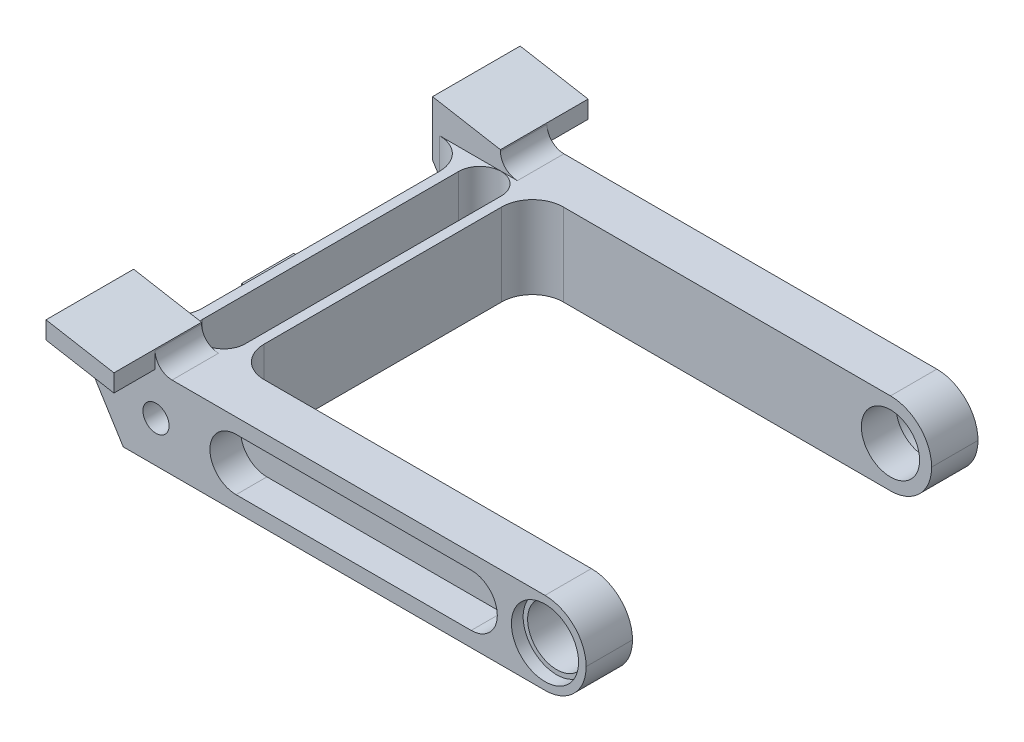
from build123d import *

# Parameters (mm, degrees)
BOSS_EXTRUDE1_DEPTH = 10.9474
CUT_EXTRUDE1_DEPTH  = 66.230102934
CUT_EXTRUDE2_DEPTH  = 63.46692107
SKETCH4_W           = 29.0576
SKETCH4_H           = 2.9464
CUT_EXTRUDE3_DEPTH  = 10.9474
CUT_EXTRUDE4_DEPTH  = 6.5278
FILLET1_R           = 4.0005
CUT_EXTRUDE5_DEPTH  = 66.230102934
CUT_EXTRUDE6_DEPTH  = 4.0005
CUT_EXTRUDE7_DEPTH  = 4.0005
SKETCH9_R           = 2.8321
CUT_EXTRUDE8_DEPTH  = 63.46692107
SKETCH10_R          = 3.2639
CUT_EXTRUDE9_DEPTH  = 1.143
CUT_EXTRUDE10_START = -1.143
SKETCH11_R          = 3.2639
CUT_EXTRUDE10_DEPTH = 1.143
CUT_EXTRUDE11_DEPTH = 2.9972
CUT_EXTRUDE13_START = -2.9972
CUT_EXTRUDE13_DEPTH = 2.9972
SKETCH14_R          = 1.27
CUT_EXTRUDE14_DEPTH = 63.46692107
SKETCH15_R          = 0.8382
BOSS_EXTRUDE2_DEPTH = 2.9972
CUT_EXTRUDE15_DEPTH = 4.0005
CUT_EXTRUDE16_DEPTH = 4.0005
SCALE1_SCALE        = 0.6


with BuildPart() as part:
    # Sketch1 → Boss-Extrude1 (new body)
    with BuildSketch(Plane(origin=(0, 0, 0), x_dir=(1, 0, 0), z_dir=(0, 1, 0))):
        with BuildLine():
            Line((0, 11.5316), (0, -11.5316))
            ThreePointArc((0, -11.5316), (-0.877859555, -13.650940445), (-2.9972, -14.5288))
            Line((-2.9972, -14.5288), (-3.683, -14.5288))
            Line((-3.683, -14.5288), (-3.683, -23.0505))
            Line((-3.683, -23.0505), (2.921, -23.0505))
            Line((2.921, -23.0505), (2.921, -19.05))
            Line((2.921, -19.05), (44.831, -19.05))
            Line((44.831, -19.05), (44.831, -14.5415))
            Line((44.831, -14.5415), (9.017, -14.5415))
            ThreePointArc((9.017, -14.5415), (6.897659555, -13.663640445), (6.0198, -11.5443))
            Line((6.0198, -11.5443), (6.0198, 11.5443))
            ThreePointArc((6.0198, 11.5443), (6.897659555, 13.663640445), (9.017, 14.5415))
            Line((9.017, 14.5415), (44.831, 14.5415))
            Line((44.831, 14.5415), (44.831, 19.05))
            Line((44.831, 19.05), (2.921, 19.05))
            Line((2.921, 19.05), (2.921, 23.0505))
            Line((2.921, 23.0505), (-3.683, 23.0505))
            Line((-3.683, 23.0505), (-3.683, 14.5288))
            Line((-3.683, 14.5288), (-2.9972, 14.5288))
            ThreePointArc((-2.9972, 14.5288), (-0.877859555, 13.650940445), (0, 11.5316))
        make_face()
    extrude(amount=BOSS_EXTRUDE1_DEPTH)

    # Sketch2 → Cut-Extrude1 (cut, through all)
    with BuildSketch(Plane.XY.offset(23.0505)):
        Polygon((-0.17535838, 0), (-3.683, 5.6134), (-3.683, 0), align=None)
    extrude(amount=-CUT_EXTRUDE1_DEPTH, mode=Mode.SUBTRACT)

    # Sketch3 → Cut-Extrude2 (cut, through all)
    with BuildSketch(Plane.XY.offset(19.05)):
        with BuildLine():
            Line((4.572, 8.001), (44.831, 8.001))
            Line((44.831, 8.001), (44.831, 10.9474))
            Line((44.831, 10.9474), (2.921, 10.9474))
            Line((2.921, 10.9474), (2.921, 9.652))
            ThreePointArc((2.921, 9.652), (3.404566704, 8.484566704), (4.572, 8.001))
        make_face()
    extrude(amount=-CUT_EXTRUDE2_DEPTH, mode=Mode.SUBTRACT)

    # Sketch4 → Cut-Extrude3 (cut)
    with BuildSketch(Plane(origin=(6.0198, 0, 0), x_dir=(0, 0, -1), z_dir=(1, 0, 0))):
        with Locations((0, 9.4742)):
            Rectangle(SKETCH4_W, SKETCH4_H)
    extrude(amount=-CUT_EXTRUDE3_DEPTH, mode=Mode.SUBTRACT)

    # Sketch5 → Cut-Extrude4 (cut)
    with BuildSketch(Plane(origin=(0, 8.001, 0), x_dir=(1, 0, 0), z_dir=(0, 1, 0))):
        with BuildLine():
            Line((0.9398, -12.446), (0.9398, 12.446))
            ThreePointArc((0.9398, 12.446), (3.0099, 14.5161), (5.08, 12.446))
            Line((5.08, 12.446), (5.08, -12.446))
            ThreePointArc((5.08, -12.446), (3.0099, -14.5161), (0.9398, -12.446))
        make_face()
    extrude(amount=-CUT_EXTRUDE4_DEPTH, mode=Mode.SUBTRACT)

    # Fillet1
    fillet1_edges = [part.edges().sort_by_distance(p)[0] for p in [
        (44.831, 8.001, -16.79575),
        (44.831, 0, -16.79575),
        (44.831, 0, 16.79575),
        (44.831, 8.001, 16.79575),
    ]]
    fillet(fillet1_edges, radius=FILLET1_R - 0.0001)  # a hair under: the kernel refuses the full size

    # Sketch6 → Cut-Extrude5 (cut, through all)
    with BuildSketch(Plane.XY.offset(23.0505)):
        Polygon((-3.683, 10.9474), (2.921, 9.782936619), (2.921, 10.9474), align=None)
    extrude(amount=-CUT_EXTRUDE5_DEPTH, mode=Mode.SUBTRACT)

    # Sketch7 → Cut-Extrude6 (cut)
    with BuildSketch(Plane.XY.offset(23.0505)):
        Polygon((-3.683, 8.987220468), (-3.683, 5.6134), (-0.17535838, 0), (2.921, 0), (2.921, 7.822757088), align=None)
    extrude(amount=-CUT_EXTRUDE6_DEPTH, mode=Mode.SUBTRACT)

    # Sketch8 → Cut-Extrude7 (cut)
    with BuildSketch(Plane(origin=(0, 0, -23.0505), x_dir=(-1, 0, 0), z_dir=(0, 0, -1))):
        Polygon((3.683, 8.987220468), (-2.921, 7.822757088), (-2.921, 0), (0.17535838, 0), (3.683, 5.6134), align=None)
    extrude(amount=-CUT_EXTRUDE7_DEPTH, mode=Mode.SUBTRACT)

    # Sketch9 → Cut-Extrude8 (cut, through all)
    with BuildSketch(Plane(origin=(0, 0, -19.05), x_dir=(-1, 0, 0), z_dir=(0, 0, -1))):
        with Locations((-40.8305, 4.0005)):
            Circle(SKETCH9_R)
    extrude(amount=-CUT_EXTRUDE8_DEPTH, mode=Mode.SUBTRACT)

    # Sketch10 → Cut-Extrude9 (cut)
    with BuildSketch(Plane(origin=(0, 0, -19.05), x_dir=(-1, 0, 0), z_dir=(0, 0, -1))):
        with Locations((-40.8305, 4.0005)):
            Circle(SKETCH10_R)
    extrude(amount=-CUT_EXTRUDE9_DEPTH, mode=Mode.SUBTRACT)

    # Sketch11 → Cut-Extrude10 (cut)
    with BuildSketch(Plane.XY.offset(19.05).offset(CUT_EXTRUDE10_START)):
        with Locations(Location((40.8305, 4.0005, 0), (0, 0, 180))):
            Circle(SKETCH11_R)
    extrude(amount=CUT_EXTRUDE10_DEPTH, mode=Mode.SUBTRACT)

    # Sketch12 → Cut-Extrude11 (cut)
    with BuildSketch(Plane.XY.offset(19.05)):
        with BuildLine():
            Line((33.655, 1.4605), (10.795, 1.4605))
            ThreePointArc((10.795, 1.4605), (8.255, 4.0005), (10.795, 6.5405))
            Line((10.795, 6.5405), (33.655, 6.5405))
            ThreePointArc((33.655, 6.5405), (36.195, 4.0005), (33.655, 1.4605))
        make_face()
    extrude(amount=-CUT_EXTRUDE11_DEPTH, mode=Mode.SUBTRACT)

    # Sketch13 → Cut-Extrude13 (cut)
    with BuildSketch(Plane(origin=(0, 0, -19.05), x_dir=(-1, 0, 0), z_dir=(0, 0, -1)).offset(CUT_EXTRUDE13_START)):
        with BuildLine():
            Line((-33.655, 6.5405), (-10.795, 6.5405))
            ThreePointArc((-10.795, 6.5405), (-8.255, 4.0005), (-10.795, 1.4605))
            Line((-10.795, 1.4605), (-33.655, 1.4605))
            ThreePointArc((-33.655, 1.4605), (-36.195, 4.0005), (-33.655, 6.5405))
        make_face()
    extrude(amount=CUT_EXTRUDE13_DEPTH, mode=Mode.SUBTRACT)

    # Sketch14 → Cut-Extrude14 (cut, through all)
    with BuildSketch(Plane(origin=(0, 0, -19.05), x_dir=(-1, 0, 0), z_dir=(0, 0, -1))):
        with Locations((-3.0099, 4.0005)):
            Circle(SKETCH14_R)
    extrude(amount=-CUT_EXTRUDE14_DEPTH, mode=Mode.SUBTRACT)

    # Sketch15 → Boss-Extrude2 (add)
    with BuildSketch(Plane.XZ):
        with BuildLine():
            Line((-5.1816, -2.54), (-5.1816, 2.54))
            Line((-5.1816, 2.54), (-2.499999953, 2.54))
            ThreePointArc((-2.499999953, 2.54), (-0.732233033, 3.272233033), (0, 5.039999953))
            Line((0, 5.039999953), (0, -5.039999953))
            ThreePointArc((0, -5.039999953), (-0.732233033, -3.272233033), (-2.499999953, -2.54))
            Line((-2.499999953, -2.54), (-5.1816, -2.54))
        make_face()
        with Locations(Location((-3.657652297, 0, 0), (0, 0, 270))):
            Circle(SKETCH15_R, mode=Mode.SUBTRACT)
    extrude(amount=-BOSS_EXTRUDE2_DEPTH)

    # Sketch16 → Cut-Extrude15 (cut)
    with BuildSketch(Plane.XY.offset(19.05)):
        Polygon((2.921, 7.822757088), (-3.683, 8.987220468), (-3.683, 9.24285301), (2.921, 8.078389629), align=None)
    extrude(amount=CUT_EXTRUDE15_DEPTH, mode=Mode.SUBTRACT)

    # Sketch17 → Cut-Extrude16 (cut)
    with BuildSketch(Plane(origin=(0, 0, -19.05), x_dir=(-1, 0, 0), z_dir=(0, 0, -1))):
        Polygon((-2.921, 8.078389629), (3.683, 9.24285301), (3.683, 8.987220468), (-2.921, 7.822757088), align=None)
    extrude(amount=CUT_EXTRUDE16_DEPTH, mode=Mode.SUBTRACT)


with BuildPart() as part_1:
    # Scale1: scaled about (13.203263525, 4.213395444, -2.977e-06)
    add(part.part.scale(SCALE1_SCALE).moved(Location((5.28130541, 1.685358178, -1.191e-06))))


solid = part_1.part
